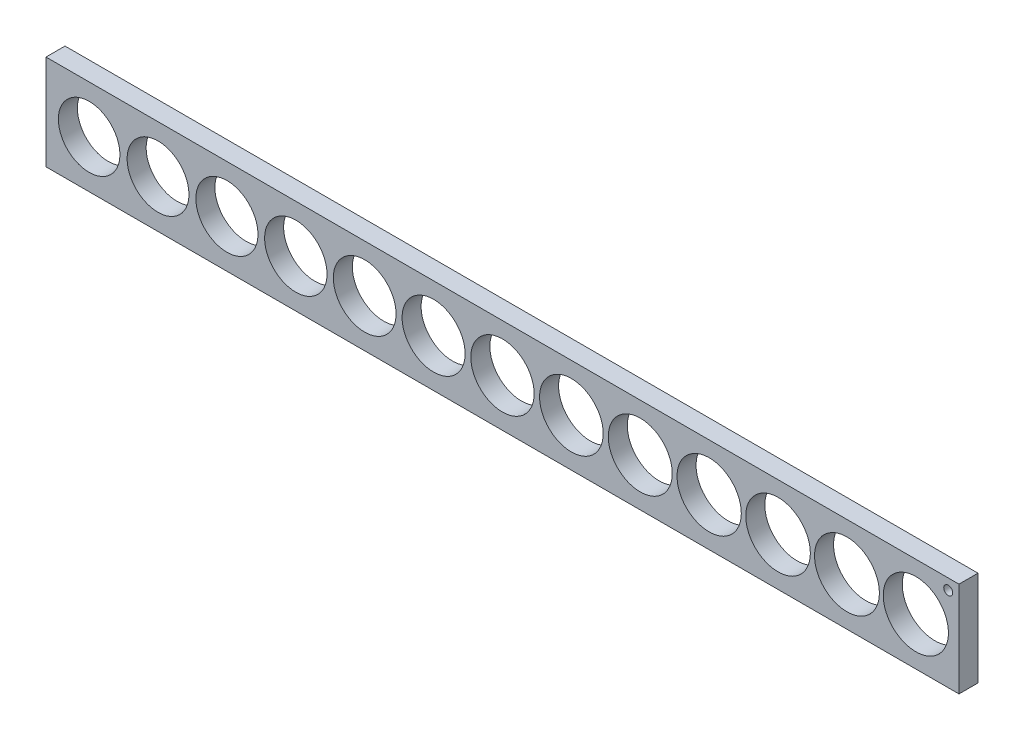
from build123d import *

# Parameters (mm, degrees)
SKETCH1_W           = 304.8
SKETCH1_H           = 31.75
SKETCH1_R           = 10.575
SKETCH1_R_2         = 10.6258
SKETCH1_R_3         = 10.6766
SKETCH1_R_4         = 10.7274
SKETCH1_R_5         = 10.7782
SKETCH1_R_6         = 10.829
SKETCH1_R_7         = 10.8798
SKETCH1_R_8         = 10.2702
SKETCH1_R_9         = 10.321
SKETCH1_R_10        = 10.3718
SKETCH1_R_11        = 10.4226
SKETCH1_R_12        = 10.4734
SKETCH1_R_13        = 10.5242
SKETCH1_R_14        = 1.5
BOSS_EXTRUDE1_DEPTH = 6.35


with BuildPart() as part:
    # Sketch1 → Boss-Extrude1 (new body)
    with BuildSketch(Plane.XY):
        Rectangle(SKETCH1_W, SKETCH1_H)
        Circle(SKETCH1_R, mode=Mode.SUBTRACT)
        with Locations((23, 0)):
            Circle(SKETCH1_R_2, mode=Mode.SUBTRACT)
        with Locations((46, 0)):
            Circle(SKETCH1_R_3, mode=Mode.SUBTRACT)
        with Locations((69, 0)):
            Circle(SKETCH1_R_4, mode=Mode.SUBTRACT)
        with Locations((92, 0)):
            Circle(SKETCH1_R_5, mode=Mode.SUBTRACT)
        with Locations((115, 0)):
            Circle(SKETCH1_R_6, mode=Mode.SUBTRACT)
        with Locations((138, 0)):
            Circle(SKETCH1_R_7, mode=Mode.SUBTRACT)
        with Locations((-138, 0)):
            Circle(SKETCH1_R_8, mode=Mode.SUBTRACT)
        with Locations((-115, 0)):
            Circle(SKETCH1_R_9, mode=Mode.SUBTRACT)
        with Locations((-92, 0)):
            Circle(SKETCH1_R_10, mode=Mode.SUBTRACT)
        with Locations((-69, 0)):
            Circle(SKETCH1_R_11, mode=Mode.SUBTRACT)
        with Locations((-46, 0)):
            Circle(SKETCH1_R_12, mode=Mode.SUBTRACT)
        with Locations((-23, 0)):
            Circle(SKETCH1_R_13, mode=Mode.SUBTRACT)
        with Locations((148.807897552, 12.282897552)):
            Circle(SKETCH1_R_14, mode=Mode.SUBTRACT)
    extrude(amount=BOSS_EXTRUDE1_DEPTH)


solid = part.part
